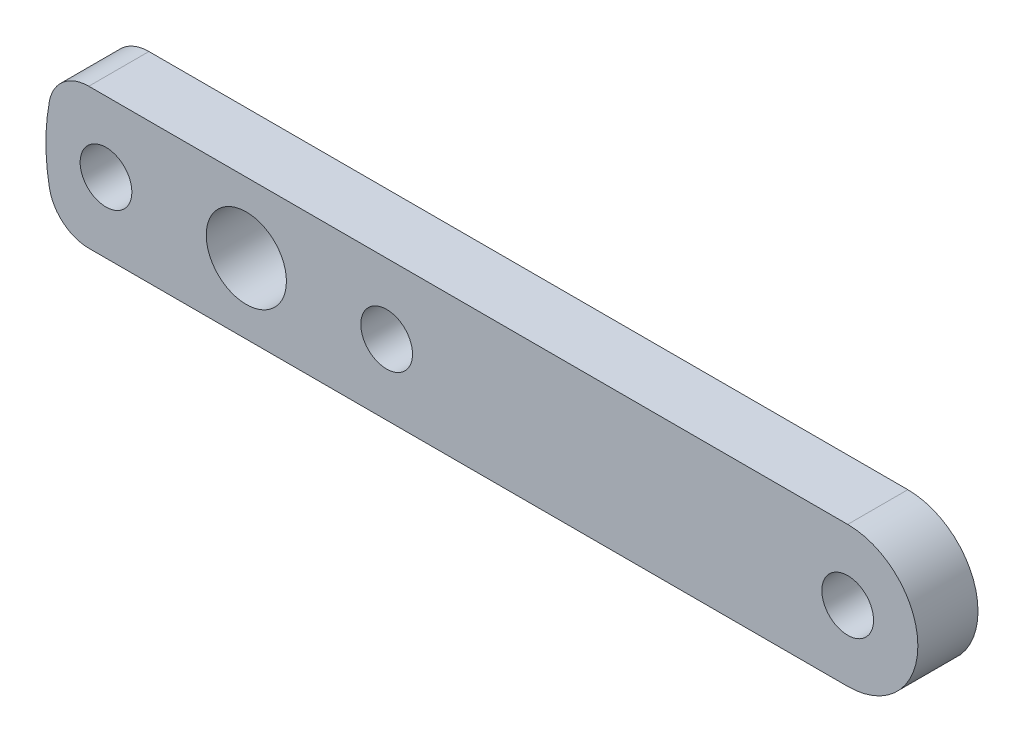
from build123d import *

# Parameters (mm, degrees)
SKETCH1_R           = 1.29
SKETCH1_R_2         = 2
BOSS_EXTRUDE1_DEPTH = 1.5
FILLET1_R           = 2


with BuildPart() as part:
    # Sketch1 → Boss-Extrude1 (new, symmetric)
    with BuildSketch(Plane.XY):
        with BuildLine():
            Line((-9.367496998, 3.5), (30, 3.5))
            ThreePointArc((30, 3.5), (33.5, 0), (30, -3.5))
            Line((30, -3.5), (-9.367496998, -3.5))
            ThreePointArc((-9.367496998, -3.5), (-10, 0), (-9.367496998, 3.5))
        make_face()
        with Locations((-7, 0)):
            Circle(SKETCH1_R, mode=Mode.SUBTRACT)
        with Locations((7, 0)):
            Circle(SKETCH1_R, mode=Mode.SUBTRACT)
        with Locations((30, 0)):
            Circle(SKETCH1_R, mode=Mode.SUBTRACT)
        Circle(SKETCH1_R_2, mode=Mode.SUBTRACT)
    extrude(amount=BOSS_EXTRUDE1_DEPTH, both=True)

    # Fillet1
    fillet1_edges = [part.edges().sort_by_distance(p)[0] for p in [
        (-9.367496998, -3.5, 0),
        (-9.367496998, 3.5, 0),
    ]]
    fillet(fillet1_edges, radius=FILLET1_R)


solid = part.part
